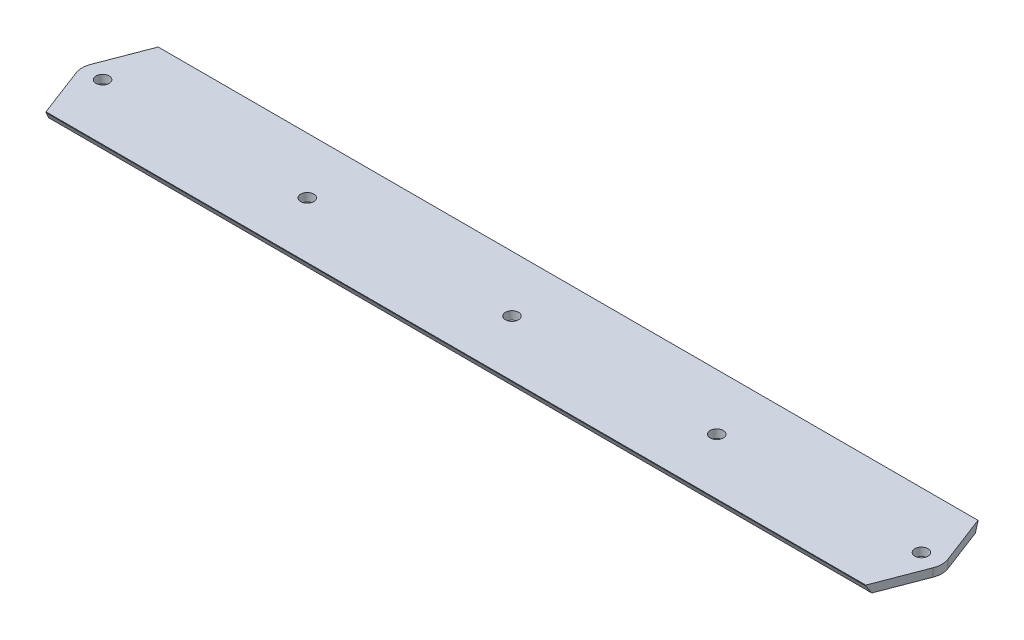
from build123d import *

# Parameters (mm, degrees)
SKETCH_1_R               = 1.6
EXTRUDE_1_DEPTH          = 2
CUT_EXTRUDE_1_DEPTH      = 5
CUT_EXTRUDE_1_DEPTH_BACK = 210
CHAMFER_2_SIZE           = 0.2
CHAMFER_2_SIZE_2         = 0.1


with BuildPart() as part:
    # Эскиз1 → Бобышка-Вытянуть1 (new body)
    with BuildSketch(Plane(origin=(0, 0, 0), x_dir=(1, 0, 0), z_dir=(0, 1, 0))):
        with BuildLine():
            Line((-125, 14), (75, 14))
            Line((75, 14), (79.670248868, 1.785714286))
            ThreePointArc((79.670248868, 1.785714286), (80, 0), (79.670248868, -1.785714286))
            Line((79.670248868, -1.785714286), (75, -14))
            Line((75, -14), (-75, -14))
            Line((-75, -14), (-125, -14))
            Line((-125, -14), (-129.670248868, -1.785714286))
            ThreePointArc((-129.670248868, -1.785714286), (-130, 0), (-129.670248868, 1.785714286))
            Line((-129.670248868, 1.785714286), (-125, 14))
        make_face()
        with Locations(Location((-75, 0, 0), (0, 0, 270))):
            Circle(SKETCH_1_R, mode=Mode.SUBTRACT)
        with Locations(Location((75, 0, 0), (0, 0, 270))):
            Circle(SKETCH_1_R, mode=Mode.SUBTRACT)
        with Locations(Location((-25, 0, 0), (0, 0, 270))):
            Circle(SKETCH_1_R, mode=Mode.SUBTRACT)
        with Locations(Location((25, 0, 0), (0, 0, 270))):
            Circle(SKETCH_1_R, mode=Mode.SUBTRACT)
        with Locations(Location((-125, 0, 0), (0, 0, 270))):
            Circle(SKETCH_1_R, mode=Mode.SUBTRACT)
    extrude(amount=EXTRUDE_1_DEPTH)

    # Эскиз4 → Вырез-Вытянуть1 (cut, two sides: drawn at the far end of the back side and taken through both)
    with BuildSketch(Plane.ZY.offset(125).offset(-CUT_EXTRUDE_1_DEPTH_BACK)):
        Polygon((-14, 2), (-14, 0), (-12.645299462, 0), (-13.8, 2), align=None)
        Polygon((14, 2), (14, 0), (12.645299462, 0), (13.8, 2), align=None)
    extrude(amount=CUT_EXTRUDE_1_DEPTH + CUT_EXTRUDE_1_DEPTH_BACK, mode=Mode.SUBTRACT)

    # Фаска2
    # the kernel refuses this chamfer: 0.2, 0.1 mm, written as the material it takes off along each edge
    with BuildSketch(Plane(origin=(-125.593889062, 2, -13.8), x_dir=(0, -0.875527030904719, 0.48316914031751595), z_dir=(1, 0, 0))) as chamfer_2_piece_1:
        Polygon((CHAMFER_2_SIZE * 0.999813220622, -CHAMFER_2_SIZE * 0.0193267656127), (CHAMFER_2_SIZE_2 * 0.483169140318, -CHAMFER_2_SIZE_2 * 0.875527030905), (0, 0), align=None)
    extrude(amount=201.187778124, mode=Mode.SUBTRACT)
    with BuildSketch(Plane(origin=(75.593889062, 2, 13.8), x_dir=(1.1200704684646426e-15, 0.07974522228289034, -0.996815278536125), z_dir=(-1, 0, 0))) as chamfer_2_piece_2:
        Polygon((CHAMFER_2_SIZE_2 * 0.996815278536, CHAMFER_2_SIZE_2 * 0.0797452222829), (CHAMFER_2_SIZE * 0.429346250941, CHAMFER_2_SIZE * 0.903139965234), (0, 0), align=None)
    extrude(amount=201.187778124, mode=Mode.SUBTRACT)


solid = part.part
